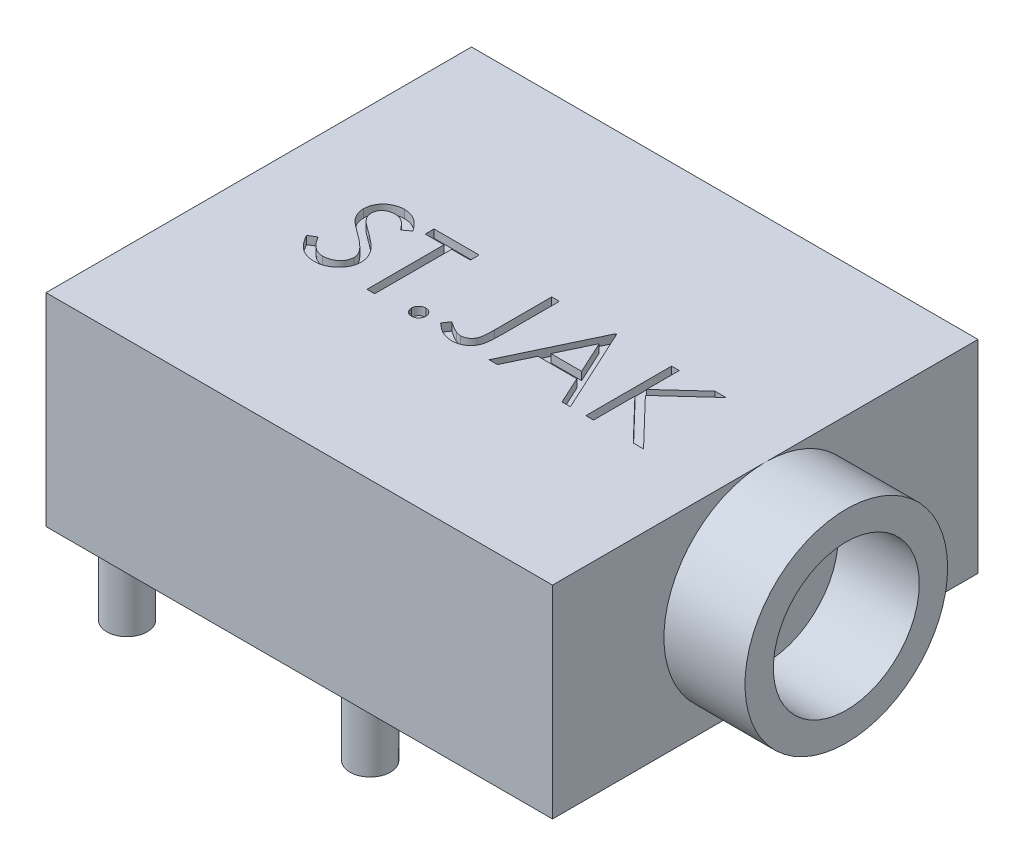
from build123d import *

# Parameters (mm, degrees)
SKETCH1_W      = 12.5
SKETCH1_H      = 10.5
EXTRUDE1_DEPTH = 5
SKETCH2_R      = 0.5
EXTRUDE2_DEPTH = 2
SKETCH3_R      = 2.5
SKETCH3_R_2    = 1.8
EXTRUDE3_DEPTH = 2
EXTRUDE4_DEPTH = 0.2


with BuildPart() as part:
    # Sketch1 → Extrude1 (new body)
    with BuildSketch(Plane(origin=(0, 0, 0), x_dir=(1, 0, 0), z_dir=(0, 1, 0))):
        with Locations((5.25, 4.25)):
            Rectangle(SKETCH1_W, SKETCH1_H)
    extrude(amount=EXTRUDE1_DEPTH)

    # Sketch2 → Extrude2 (add)
    with BuildSketch(Plane.XZ):
        Circle(SKETCH2_R)
        with Locations((6, 0)):
            Circle(SKETCH2_R)
        with Locations((0, -8.5)):
            Circle(SKETCH2_R)
        with Locations((4, -8.5)):
            Circle(SKETCH2_R)
        with Locations((8.5, -8.5)):
            Circle(SKETCH2_R)
    extrude(amount=EXTRUDE2_DEPTH)

    # Sketch3 → Extrude3 (add)
    with BuildSketch(Plane(origin=(11.5, 0, 0), x_dir=(0, 0, -1), z_dir=(1, 0, 0))):
        with Locations((4.25, 2.5)):
            Circle(SKETCH3_R)
        with Locations((4.25, 2.5)):
            Circle(SKETCH3_R_2, mode=Mode.SUBTRACT)
    extrude(amount=EXTRUDE3_DEPTH)

    # Sketch4 → Extrude4 (cut)
    # profile 1 of 6: a face of its own
    with BuildSketch(Plane(origin=(0, 5, 0), x_dir=(1, 0, 0), z_dir=(0, 1, 0))):
        with BuildLine():
            Line((0.989662682, 3.440339743), (1.168595642, 3.547614716))
            add(Edge.make_bspline(
                [(1.168595642, 3.547614716), (1.185237623, 3.519756731), (1.217123018, 3.466381907), (1.270312649, 3.394259187), (1.325426362, 3.332959216), (1.382872292, 3.282838601), (1.442299794, 3.24337856), (1.504096817, 3.21543721), (1.568055112, 3.198010406), (1.611582138, 3.195893687), (1.633312522, 3.194836939)],
                knots=[0, 0, 0, 0, 1.272034388, 2.437168799, 3.508375237, 4.49857839, 5.41946034, 6.295179144, 7.148887113, 8, 8, 8, 8], degree=3))
            add(Edge.make_bspline(
                [(1.633312522, 3.194836939), (1.651870766, 3.195353812), (1.688662529, 3.196378515), (1.742826362, 3.206224524), (1.795429642, 3.221350906), (1.845388199, 3.243014041), (1.89201269, 3.269223506), (1.932898644, 3.30088048), (1.968244626, 3.336323281), (1.997157758, 3.37586422), (2.019340446, 3.418389352), (2.036389935, 3.462038618), (2.045851479, 3.507497705), (2.047276754, 3.538104985), (2.047996016, 3.553550881)],
                knots=[0, 0, 0, 0, 1.095163259, 2.171163733, 3.241058638, 4.321873601, 5.38011039, 6.391990106, 7.366004449, 8.327778327, 9.272591725, 10.192022065, 11.087607919, 12, 12, 12, 12], degree=3))
            add(Edge.make_bspline(
                [(2.047996016, 3.553550881), (2.047104409, 3.571174157), (2.045291902, 3.606999701), (2.029972388, 3.659855682), (2.005873081, 3.712163093), (1.983640435, 3.74451862), (1.972097912, 3.76131664)],
                knots=[0, 0, 0, 0, 0.938893495, 1.908633276, 2.914225137, 4, 4, 4, 4], degree=3))
            add(Edge.make_bspline(
                [(1.972097912, 3.76131664), (1.962620922, 3.773440195), (1.942725165, 3.798892082), (1.908521336, 3.836777534), (1.868385639, 3.875856293), (1.823691584, 3.917620579), (1.772811097, 3.960127961), (1.717337791, 4.005405444), (1.655855362, 4.051731159), (1.612736142, 4.08279933), (1.590487335, 4.098829994)],
                knots=[0, 0, 0, 0, 0.722233717, 1.516239348, 2.393582979, 3.351407094, 4.387010283, 5.505090956, 6.712668013, 8, 8, 8, 8], degree=3))
            add(Edge.make_bspline(
                [(1.590487335, 4.098829994), (1.568217585, 4.114692045), (1.525639519, 4.145019078), (1.466095519, 4.19002805), (1.412849582, 4.23117839), (1.366138367, 4.268857483), (1.32598242, 4.303070439), (1.29206531, 4.333488716), (1.26525104, 4.360934965), (1.250340284, 4.378739967), (1.243645722, 4.386733974)],
                knots=[0, 0, 0, 0, 1.452282411, 2.77665338, 3.964542531, 5.026858415, 5.96415736, 6.766646006, 7.446254459, 8, 8, 8, 8], degree=3))
            add(Edge.make_bspline(
                [(1.243645722, 4.386733974), (1.234288516, 4.399192696), (1.215886315, 4.423694446), (1.191595445, 4.461990907), (1.17094938, 4.501193549), (1.154764541, 4.541407714), (1.141135494, 4.582068838), (1.131968555, 4.623707449), (1.12622852, 4.666136708), (1.125640699, 4.694689635), (1.125346443, 4.708982906)],
                knots=[0, 0, 0, 0, 1.068054152, 2.10047183, 3.106115577, 4.101338837, 5.06977816, 6.043150881, 7.020423561, 8, 8, 8, 8], degree=3))
            add(Edge.make_bspline(
                [(1.125346443, 4.708982906), (1.126135784, 4.731377103), (1.127697593, 4.775686836), (1.140905906, 4.840415005), (1.161753799, 4.902213458), (1.190960707, 4.960470374), (1.228611583, 5.013668848), (1.272182243, 5.062420814), (1.324077761, 5.103404671), (1.381017681, 5.139213868), (1.443342249, 5.167242118), (1.508651033, 5.188385187), (1.577047834, 5.200365071), (1.623374492, 5.202084267), (1.646880898, 5.202956597)],
                knots=[0, 0, 0, 0, 1.005424448, 1.989358655, 2.955360095, 3.929531133, 4.905563448, 5.876582895, 6.856512386, 7.866279853, 8.892233794, 9.918561126, 10.94386622, 12, 12, 12, 12], degree=3))
            add(Edge.make_bspline(
                [(1.646880898, 5.202956597), (1.671823759, 5.202096292), (1.721427148, 5.20038542), (1.794391197, 5.18550977), (1.864640773, 5.160895554), (1.9211517, 5.132962413), (1.965379608, 5.10506389), (1.999108832, 5.079651901), (2.033288433, 5.050396479), (2.068194114, 5.017219696), (2.103234418, 4.979817137), (2.138929553, 4.938444959), (2.175362992, 4.893355994), (2.19880106, 4.861167844), (2.210816528, 4.844666666)],
                knots=[0, 0, 0, 0, 1.286793592, 2.559021753, 3.825965368, 5.121522368, 5.803751409, 6.523245864, 7.299691795, 8.125521123, 9.008227632, 9.944561021, 10.946284179, 12, 12, 12, 12], degree=3))
            Line((2.210816528, 4.844666666), (2.039091769, 4.714495058))
            add(Edge.make_bspline(
                [(2.039091769, 4.714495058), (2.028722562, 4.727853457), (2.008753894, 4.753578609), (1.97843749, 4.789605071), (1.949863308, 4.822514085), (1.9217114, 4.851098234), (1.895468584, 4.876922858), (1.869997802, 4.899032806), (1.845665599, 4.917644713), (1.814993943, 4.937507247), (1.776459895, 4.95719618), (1.728088294, 4.973856813), (1.677538499, 4.983868684), (1.643109627, 4.98519244), (1.625680311, 4.98586258)],
                knots=[0, 0, 0, 0, 1.181633172, 2.275549214, 3.290209073, 4.226197932, 5.078386478, 5.862611352, 6.581680152, 7.217281963, 8.414376989, 9.595101626, 10.782541182, 12, 12, 12, 12], degree=3))
            add(Edge.make_bspline(
                [(1.625680311, 4.98586258), (1.603814223, 4.98512979), (1.561647534, 4.983716673), (1.50178201, 4.968283158), (1.447901398, 4.9439827), (1.401605323, 4.909925547), (1.363059627, 4.869575232), (1.335176802, 4.823142305), (1.31839456, 4.771869138), (1.316346667, 4.736102517), (1.315303708, 4.717887152)],
                knots=[0, 0, 0, 0, 1.14458467, 2.207223713, 3.21896685, 4.227309161, 5.202851033, 6.127160689, 7.046193047, 8, 8, 8, 8], degree=3))
            add(Edge.make_bspline(
                [(1.315303708, 4.717887152), (1.315541456, 4.706546973), (1.316017341, 4.683848069), (1.32265448, 4.650313162), (1.331181217, 4.616862971), (1.34469319, 4.583647885), (1.363347254, 4.550087011), (1.387843242, 4.515602436), (1.41869415, 4.479890212), (1.442326438, 4.456662896), (1.454803574, 4.444399572)],
                knots=[0, 0, 0, 0, 0.858281714, 1.717966888, 2.583508476, 3.4729293, 4.427298488, 5.488583878, 6.674047936, 8, 8, 8, 8], degree=3))
            add(Edge.make_bspline(
                [(1.454803574, 4.444399572), (1.459436881, 4.4402648), (1.470444555, 4.430441526), (1.490568568, 4.414359528), (1.517143498, 4.394521661), (1.549475401, 4.369975998), (1.588160424, 4.341502923), (1.633202822, 4.3094665), (1.684100511, 4.272826723), (1.720218051, 4.247210496), (1.73931546, 4.233665731)],
                knots=[0, 0, 0, 0, 0.420754252, 0.999615792, 1.744751191, 2.668019286, 3.750313428, 4.999500688, 6.413464383, 8, 8, 8, 8], degree=3))
            add(Edge.make_bspline(
                [(1.73931546, 4.233665731), (1.762287893, 4.21694929), (1.806770827, 4.184580219), (1.870063744, 4.135947879), (1.927451904, 4.088384704), (1.979136794, 4.042194437), (2.025629019, 3.997727448), (2.066412784, 3.954448762), (2.101903648, 3.91266844), (2.140112032, 3.85910312), (2.179154142, 3.793316465), (2.212683054, 3.712714863), (2.23382453, 3.631799946), (2.236589209, 3.577415621), (2.237953281, 3.550582799)],
                knots=[0, 0, 0, 0, 1.163667725, 2.253281268, 3.268753668, 4.215851969, 5.092017293, 5.902905408, 6.650798638, 7.335211899, 8.59617414, 9.77448103, 10.901945474, 12, 12, 12, 12], degree=3))
            add(Edge.make_bspline(
                [(2.237953281, 3.550582799), (2.237555868, 3.531606359), (2.236768762, 3.494021989), (2.227720971, 3.438834395), (2.214464793, 3.385233821), (2.194485132, 3.333882815), (2.170099222, 3.283841935), (2.139155825, 3.236423824), (2.103288796, 3.190579002), (2.062144567, 3.147529938), (2.017122521, 3.108011048), (1.96953762, 3.072856806), (1.919311979, 3.04354501), (1.866718064, 3.019626168), (1.811743793, 3.000918755), (1.754407657, 2.987364305), (1.694615143, 2.979045375), (1.653974852, 2.97818192), (1.633312522, 2.977742922)],
                knots=[0, 0, 0, 0, 0.983748083, 1.948392443, 2.894712957, 3.844097841, 4.80183111, 5.778335162, 6.776009319, 7.81870978, 8.863265674, 9.881300176, 10.883814829, 11.87499822, 12.874611388, 13.892143829, 14.928324115, 16, 16, 16, 16], degree=3))
            add(Edge.make_bspline(
                [(1.633312522, 2.977742922), (1.617325434, 2.978052065), (1.585552598, 2.978666458), (1.538556864, 2.984097994), (1.492510541, 2.991782766), (1.447991427, 3.003983275), (1.404425945, 3.018786018), (1.36200357, 3.037012534), (1.320703742, 3.058854841), (1.280295013, 3.083828499), (1.240880155, 3.112891992), (1.202828858, 3.146742631), (1.164892636, 3.184446817), (1.128191211, 3.227028443), (1.091982214, 3.27379957), (1.056979557, 3.32519779), (1.022458709, 3.380943142), (1.000798878, 3.420171075), (0.989662682, 3.440339743)],
                knots=[0, 0, 0, 0, 0.915332311, 1.819136955, 2.706846663, 3.586547465, 4.459518054, 5.340707479, 6.227863349, 7.133153174, 8.059268498, 9.028702269, 10.047606654, 11.120612155, 12.245963614, 13.433783089, 14.680604001, 16, 16, 16, 16], degree=3))
        make_face()
    # profile 2 of 6: a face of its own
    with BuildSketch(Plane(origin=(0, 5, 0), x_dir=(1, 0, 0), z_dir=(0, 1, 0))):
        Polygon((2.427910546, 4.931589075), (2.427910546, 5.148683093), (3.540517383, 5.148683093), (3.540517383, 4.931589075), (3.079192597, 4.931589075), (3.079192597, 3.032016426), (2.889235332, 3.032016426), (2.889235332, 4.931589075), align=None)
    # profile 3 of 6: a face of its own
    with BuildSketch(Plane(origin=(0, 5, 0), x_dir=(1, 0, 0), z_dir=(0, 1, 0))):
        with BuildLine():
            add(Edge.make_bspline(
                [(4.015410546, 3.357657452), (4.027197483, 3.356957036), (4.050304397, 3.355583955), (4.083710917, 3.346163776), (4.113945783, 3.329436871), (4.140877188, 3.307143667), (4.163075867, 3.280113433), (4.18039888, 3.250119717), (4.189737, 3.216433516), (4.19110008, 3.193192712), (4.191799434, 3.181268563)],
                knots=[0, 0, 0, 0, 1.020151414, 1.999887582, 2.974338812, 3.990962822, 5.007586832, 5.987933904, 6.967670073, 8, 8, 8, 8], degree=3))
            add(Edge.make_bspline(
                [(4.191799434, 3.181268563), (4.191076381, 3.16963093), (4.189650529, 3.146681689), (4.180420285, 3.113249566), (4.162943845, 3.083237105), (4.141030302, 3.055840098), (4.113939126, 3.033499666), (4.083639437, 3.016915072), (4.050382819, 3.006820399), (4.027210567, 3.005534495), (4.015410546, 3.004879674)],
                knots=[0, 0, 0, 0, 1.009421747, 1.99056486, 2.972319754, 3.999869655, 5.017953583, 5.993804169, 6.978383603, 8, 8, 8, 8], degree=3))
            add(Edge.make_bspline(
                [(4.015410546, 3.004879674), (4.003602022, 3.005510802), (3.98054869, 3.006742928), (3.947416208, 3.01712234), (3.916931993, 3.033344147), (3.889846091, 3.055881754), (3.867749016, 3.083096126), (3.851042237, 3.11345626), (3.841009146, 3.146585987), (3.839689633, 3.16961208), (3.839021657, 3.181268563)],
                knots=[0, 0, 0, 0, 1.022052826, 1.995314843, 2.982371812, 4.00089066, 5.028879526, 6.005146991, 6.990147033, 8, 8, 8, 8], degree=3))
            add(Edge.make_bspline(
                [(3.839021657, 3.181268563), (3.839663974, 3.193212235), (3.840918019, 3.21653079), (3.8510633, 3.249913107), (3.86761939, 3.280253068), (3.889998843, 3.307102428), (3.916925441, 3.329591892), (3.94734267, 3.345959648), (3.980628487, 3.355660278), (4.00361545, 3.356980181), (4.015410546, 3.357657452)],
                knots=[0, 0, 0, 0, 1.032775665, 2.016367738, 2.991239715, 4.008302682, 5.025365648, 6.011011707, 6.979408107, 8, 8, 8, 8], degree=3))
        make_face()
    # profile 4 of 6: a face of its own
    with BuildSketch(Plane(origin=(0, 5, 0), x_dir=(1, 0, 0), z_dir=(0, 1, 0))):
        with BuildLine():
            Line((5.331543024, 5.148683093), (5.521500289, 5.148683093))
            Line((5.521500289, 5.148683093), (5.521500289, 3.719339476))
            add(Edge.make_bspline(
                [(5.521500289, 3.719339476), (5.521310443, 3.692908254), (5.520945916, 3.642157081), (5.518941486, 3.569057154), (5.515232193, 3.502309168), (5.509828637, 3.441761345), (5.502619735, 3.387603371), (5.494370161, 3.339416778), (5.484383849, 3.297603732), (5.469345557, 3.250652827), (5.444687027, 3.199161097), (5.40757458, 3.143550125), (5.361471889, 3.094907062), (5.308070787, 3.052662795), (5.246904549, 3.019003422), (5.179232769, 2.994840053), (5.105472023, 2.980101487), (5.054309642, 2.978544887), (5.02795061, 2.977742922)],
                knots=[0, 0, 0, 0, 1.237770943, 2.376671248, 3.424123796, 4.367912054, 5.222547132, 5.982086412, 6.656319012, 7.234008312, 8.288027371, 9.317870876, 10.352700517, 11.413286737, 12.494591526, 13.606319346, 14.766767577, 16, 16, 16, 16], degree=3))
            add(Edge.make_bspline(
                [(5.02795061, 2.977742922), (5.007413888, 2.978396433), (4.966092645, 2.979711341), (4.904593978, 2.990428758), (4.843269926, 3.00694846), (4.781795002, 3.031140506), (4.718954651, 3.064042939), (4.653897784, 3.107092805), (4.585787569, 3.160209966), (4.540924343, 3.20075184), (4.51744046, 3.221973691)],
                knots=[0, 0, 0, 0, 0.848567217, 1.707373443, 2.573483905, 3.470863513, 4.432650262, 5.500696352, 6.691726801, 8, 8, 8, 8], degree=3))
            Line((4.51744046, 3.221973691), (4.629379563, 3.384794204))
            add(Edge.make_bspline(
                [(4.629379563, 3.384794204), (4.655204516, 3.36698554), (4.703965396, 3.333360462), (4.775632367, 3.290103899), (4.839130645, 3.253016775), (4.880667475, 3.234116587), (4.899899061, 3.225365785)],
                knots=[0, 0, 0, 0, 1.196737151, 2.259595785, 3.194191475, 4, 4, 4, 4], degree=3))
            add(Edge.make_bspline(
                [(4.899899061, 3.225365785), (4.911561478, 3.220794113), (4.934434074, 3.211828047), (4.96940448, 3.201821718), (5.004175288, 3.196353213), (5.027227417, 3.195336406), (5.038550903, 3.194836939)],
                knots=[0, 0, 0, 0, 1.051806502, 2.062826769, 3.048436908, 4, 4, 4, 4], degree=3))
            add(Edge.make_bspline(
                [(5.038550903, 3.194836939), (5.053175733, 3.19545545), (5.082083628, 3.196678018), (5.124092805, 3.20747258), (5.164284091, 3.223948957), (5.201216693, 3.248073692), (5.235255951, 3.276758408), (5.263342803, 3.311445137), (5.286757517, 3.349887423), (5.300848284, 3.386276826), (5.309825837, 3.419464121), (5.315523678, 3.449964161), (5.320506106, 3.485621817), (5.324849235, 3.526479652), (5.327391938, 3.572619467), (5.330244765, 3.623905782), (5.331276042, 3.6804679), (5.331451315, 3.719905), (5.331543024, 3.740540064)],
                knots=[0, 0, 0, 0, 0.997221856, 1.971139923, 2.944579524, 3.951425367, 4.971190333, 5.972282193, 6.985401279, 8.033996657, 8.624075553, 9.332086008, 10.151144245, 11.082816738, 12.137127781, 13.306538797, 14.590673636, 16, 16, 16, 16], degree=3))
            Line((5.331543024, 3.740540064), (5.331543024, 5.148683093))
        make_face()
    # profile 5 of 6: a face of its own
    with BuildSketch(Plane(origin=(0, 5, 0), x_dir=(1, 0, 0), z_dir=(0, 1, 0))):
        Polygon((6.9326114, 5.148683093), (7.909534477, 3.032016426), (7.703040754, 3.032016426), (7.390120081, 3.710435229), (6.430581486, 3.710435229), (6.108756566, 3.032016426), (5.901414819, 3.032016426), (6.905474648, 5.148683093), align=None)
        Polygon((6.916922965, 4.736119658), (6.533616341, 3.927529246), (7.290053307, 3.927529246), align=None, mode=Mode.SUBTRACT)
    # profile 6 of 6: a face of its own
    with BuildSketch(Plane(origin=(0, 5, 0), x_dir=(1, 0, 0), z_dir=(0, 1, 0))):
        Polygon((8.289449007, 5.148683093), (8.479406272, 5.148683093), (8.479406272, 4.342636752), (9.361774728, 5.148683093), (9.632718238, 5.148683093), (8.59261741, 4.198896768), (9.714128494, 3.032016426), (9.460993478, 3.032016426), (8.479406272, 4.053460737), (8.479406272, 3.032016426), (8.289449007, 3.032016426), align=None)
    extrude(amount=-EXTRUDE4_DEPTH, mode=Mode.SUBTRACT)


solid = part.part
